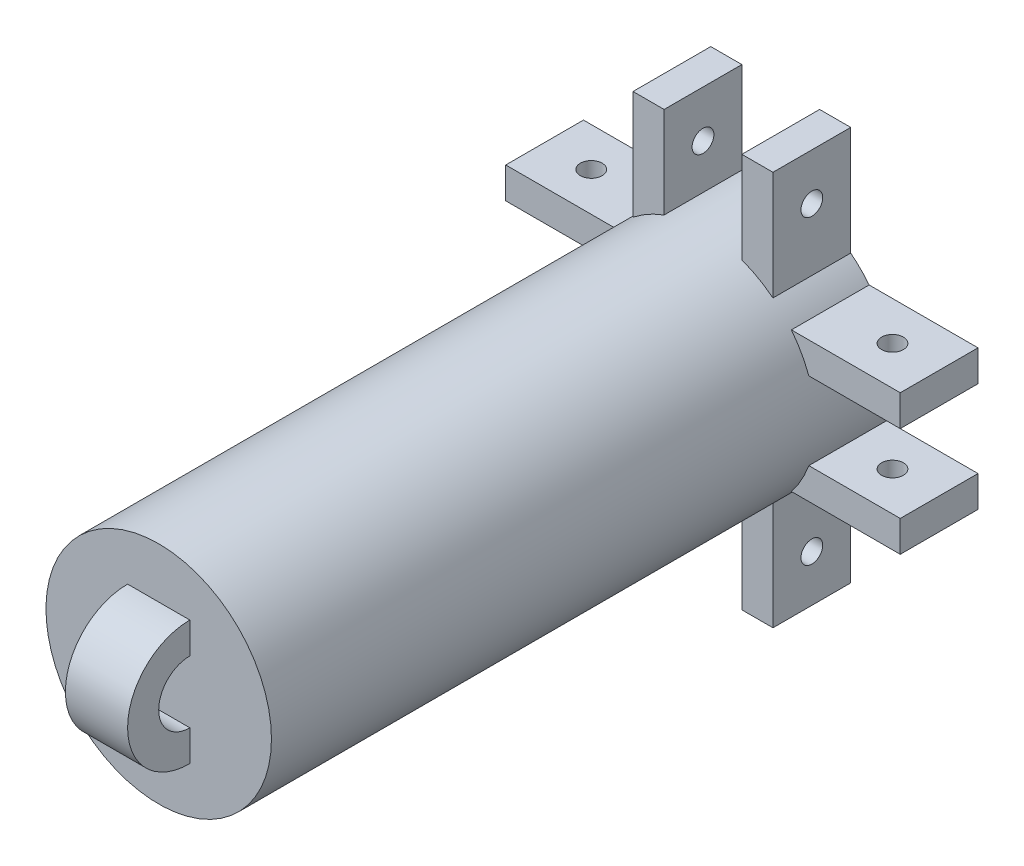
from build123d import *
from build123d.topology import SkipClean

# Parameters (mm, degrees)
SKETCH1_R                = 18.415
BOSS_EXTRUDE1_DEPTH      = 101.6
BOSS_EXTRUDE4_DEPTH      = 12.7
SKETCH9_R                = 1.778
CUT_EXTRUDE2_DEPTH       = 25.4
BOSS_EXTRUDE5_DEPTH      = 5.08
BOSS_EXTRUDE5_DEPTH_BACK = 5.08
CUT_EXTRUDE3_DEPTH       = 15.24
CUT_EXTRUDE4_START       = -12.7
CUT_EXTRUDE4_DEPTH       = 12.7
CIRPATTERN1_COUNT        = 4


with BuildPart() as part:
    # Sketch1 → Boss-Extrude1 (new body)
    with BuildSketch(Plane.XY):
        Circle(SKETCH1_R)
    extrude(amount=BOSS_EXTRUDE1_DEPTH)

    # Sketch8 → Boss-Extrude4 (add)
    with BuildSketch(Plane.XY):
        with BuildLine():
            Line((-14.438397591, 11.43), (-32.218397591, 11.43))
            Line((-32.218397591, 11.43), (-32.218397591, -11.43))
            Line((-32.218397591, -11.43), (-14.438397591, -11.43))
            ThreePointArc((-14.438397591, -11.43), (-18.415, 0), (-14.438397591, 11.43))
        make_face()
    boss_extrude4 = extrude(amount=BOSS_EXTRUDE4_DEPTH)

    # Sketch9 → Cut-Extrude2 (cut)
    with BuildSketch(Plane.XZ.offset(11.43)):
        with Locations((-24.598397591, 6.35)):
            Circle(SKETCH9_R)
    cut_extrude2 = extrude(amount=-CUT_EXTRUDE2_DEPTH, mode=Mode.SUBTRACT)

    # Sketch13 → Boss-Extrude5 (add, two sides: drawn at the far end of the back side and taken through both)
    with BuildSketch(Plane(origin=(0, 0, 0), x_dir=(0, 0, -1), z_dir=(1, 0, 0)).offset(-BOSS_EXTRUDE5_DEPTH_BACK)):
        with BuildLine():
            Line((-101.6, 10.16), (-101.6, -10.16))
            ThreePointArc((-101.6, -10.16), (-111.76, 0), (-101.6, 10.16))
        make_face()
    extrude(amount=BOSS_EXTRUDE5_DEPTH + BOSS_EXTRUDE5_DEPTH_BACK)

    # Sketch14 → Cut-Extrude3 (cut)
    with BuildSketch(Plane(origin=(5.08, 0, 0), x_dir=(0, 0, -1), z_dir=(1, 0, 0))):
        with BuildLine():
            Line((-101.6, 5.08), (-101.6, -5.08))
            ThreePointArc((-101.6, -5.08), (-106.68, 0), (-101.6, 5.08))
        make_face()
    extrude(amount=-CUT_EXTRUDE3_DEPTH, mode=Mode.SUBTRACT)

    # Sketch15 → Cut-Extrude4 (cut)
    with SkipClean():  # the faces are left unmerged after this step: merging them gives an invalid solid
        with BuildSketch(Plane.XY.offset(12.7).offset(CUT_EXTRUDE4_START)):
            with BuildLine():
                Line((-17.285535138, 6.35), (-32.218397591, 6.35))
                Line((-32.218397591, 6.35), (-32.218397591, -6.35))
                Line((-32.218397591, -6.35), (-17.285535138, -6.35))
                ThreePointArc((-17.285535138, -6.35), (-18.415, 0), (-17.285535138, 6.35))
            make_face()
        cut_extrude4 = extrude(amount=CUT_EXTRUDE4_DEPTH, mode=Mode.SUBTRACT)

    # CirPattern1: Boss-Extrude4, Cut-Extrude2, Cut-Extrude4 ×4 about axis
    with SkipClean():  # the faces are left unmerged after this step: merging them gives an invalid solid
        cirpattern1_axis = Axis((0, 0, 101.6), (0, 0, -1))
        add([boss_extrude4.rotate(cirpattern1_axis, i * 360 / CIRPATTERN1_COUNT) for i in range(1, CIRPATTERN1_COUNT)])
        add([cut_extrude2.rotate(cirpattern1_axis, i * 360 / CIRPATTERN1_COUNT) for i in range(1, CIRPATTERN1_COUNT)], mode=Mode.SUBTRACT)
        add([cut_extrude4.rotate(cirpattern1_axis, i * 360 / CIRPATTERN1_COUNT) for i in range(1, CIRPATTERN1_COUNT)], mode=Mode.SUBTRACT)


solid = part.part
